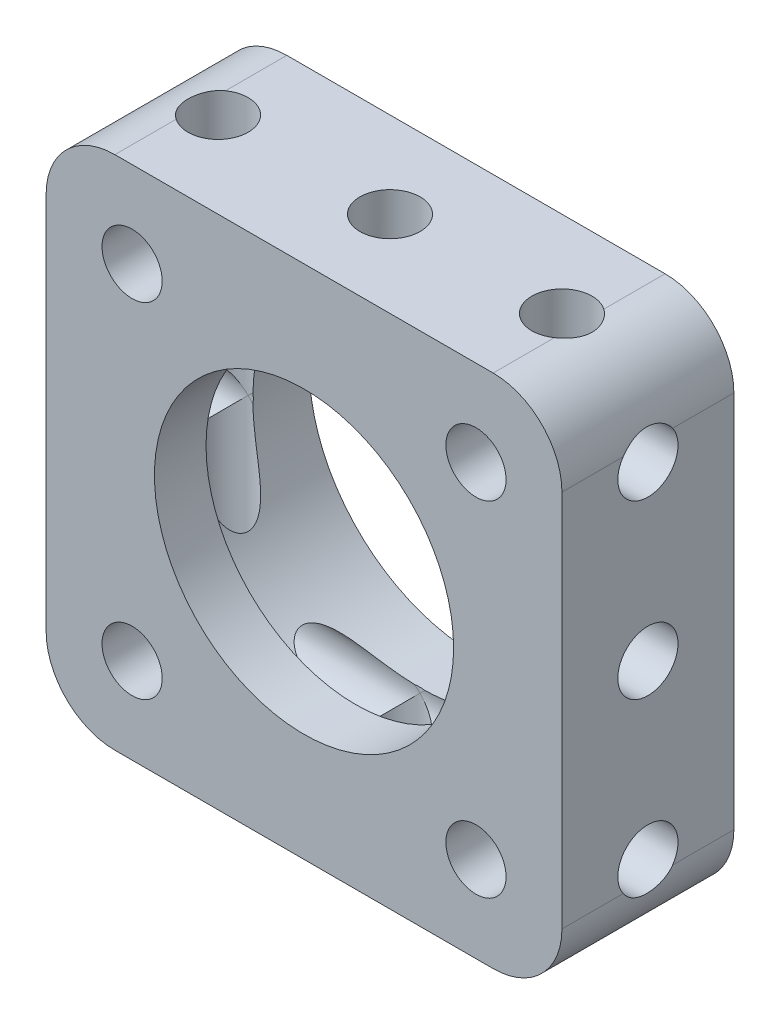
from build123d import *

# Parameters (mm, degrees)
ESQUISSE1_W             = 30
ESQUISSE1_H             = 30
ESQUISSE1_R             = 9.7
ESQUISSE1_R_2           = 1.75
BOSS_EXTRU_1_DEPTH      = 10
BOSS_EXTRU_2_START      = -3
ESQUISSE2_R             = 9.7
ESQUISSE2_R_2           = 8.7
BOSS_EXTRU_2_DEPTH      = 3
ESQUISSE3_R             = 1.75
ENL_V_MAT_EXTRU_1_DEPTH = 36
ESQUISSE4_R             = 1.75
ENL_V_MAT_EXTRU_2_DEPTH = 36.000000043
CONG_1_START            = -1
CONG_1_DEPTH            = 12


with BuildPart() as part:
    # Esquisse1 → Boss.-Extru.1 (new body)
    with BuildSketch(Plane.XY):
        Rectangle(ESQUISSE1_W, ESQUISSE1_H)
        Circle(ESQUISSE1_R, mode=Mode.SUBTRACT)
        with Locations((10, 10)):
            Circle(ESQUISSE1_R_2, mode=Mode.SUBTRACT)
        with Locations((-10, 10)):
            Circle(ESQUISSE1_R_2, mode=Mode.SUBTRACT)
        with Locations((-10, -10)):
            Circle(ESQUISSE1_R_2, mode=Mode.SUBTRACT)
        with Locations((10, -10)):
            Circle(ESQUISSE1_R_2, mode=Mode.SUBTRACT)
    extrude(amount=BOSS_EXTRU_1_DEPTH)

    # Esquisse2 → Boss.-Extru.2 (add)
    with BuildSketch(Plane.XY.offset(10).offset(BOSS_EXTRU_2_START)):
        with Locations(Location((0, 0, 0), (0, 0, 180))):
            Circle(ESQUISSE2_R)
        Circle(ESQUISSE2_R_2, mode=Mode.SUBTRACT)
    extrude(amount=BOSS_EXTRU_2_DEPTH)

    # Esquisse3 → Enlèv. mat.-Extru.1 (cut, through all)
    with BuildSketch(Plane.XZ.offset(15)):
        with Locations((-30, 5)):
            Circle(ESQUISSE3_R)
        with Locations((-20, 5)):
            Circle(ESQUISSE3_R)
        with Locations((-10, 5)):
            Circle(ESQUISSE3_R)
        with Locations(Location((0, 5, 0), (0, 0, 270))):
            Circle(ESQUISSE3_R)
        with Locations((10, 5)):
            Circle(ESQUISSE3_R)
    extrude(amount=-ENL_V_MAT_EXTRU_1_DEPTH, mode=Mode.SUBTRACT)

    # Esquisse4 → Enlèv. mat.-Extru.2 (cut, through all)
    with BuildSketch(Plane.ZY.offset(15)):
        with Locations(Location((5, -10, 0), (0, 0, 315))):
            Circle(ESQUISSE4_R)
        with Locations(Location((5, 0, 0), (0, 0, 270))):
            Circle(ESQUISSE4_R)
        with Locations(Location((5, 10, 0), (0, 0, 225))):
            Circle(ESQUISSE4_R)
    extrude(amount=-ENL_V_MAT_EXTRU_2_DEPTH, mode=Mode.SUBTRACT)

    # Congé1: read off the stored shape, not the designer's step
    # Congé1 outline → Congé1 (cut)
    with BuildSketch(Plane.XY.offset(CONG_1_START)):
        with BuildLine():
            Line((15, -15), (15, -11))
            ThreePointArc((15, -11), (13.828427125, -13.828427125), (11, -15))
            Line((11, -15), (15, -15))
        make_face()
        with BuildLine():
            ThreePointArc((11, 15), (13.828427125, 13.828427125), (15, 11))
            Line((15, 11), (15, 15))
            Line((15, 15), (11, 15))
        make_face()
        with BuildLine():
            Line((-15, -15), (-11, -15))
            ThreePointArc((-11, -15), (-13.828427125, -13.828427125), (-15, -11))
            Line((-15, -11), (-15, -15))
        make_face()
        with BuildLine():
            ThreePointArc((-15, 11), (-13.828427125, 13.828427125), (-11, 15))
            Line((-11, 15), (-15, 15))
            Line((-15, 15), (-15, 11))
        make_face()
    extrude(amount=CONG_1_DEPTH, mode=Mode.SUBTRACT)


solid = part.part
